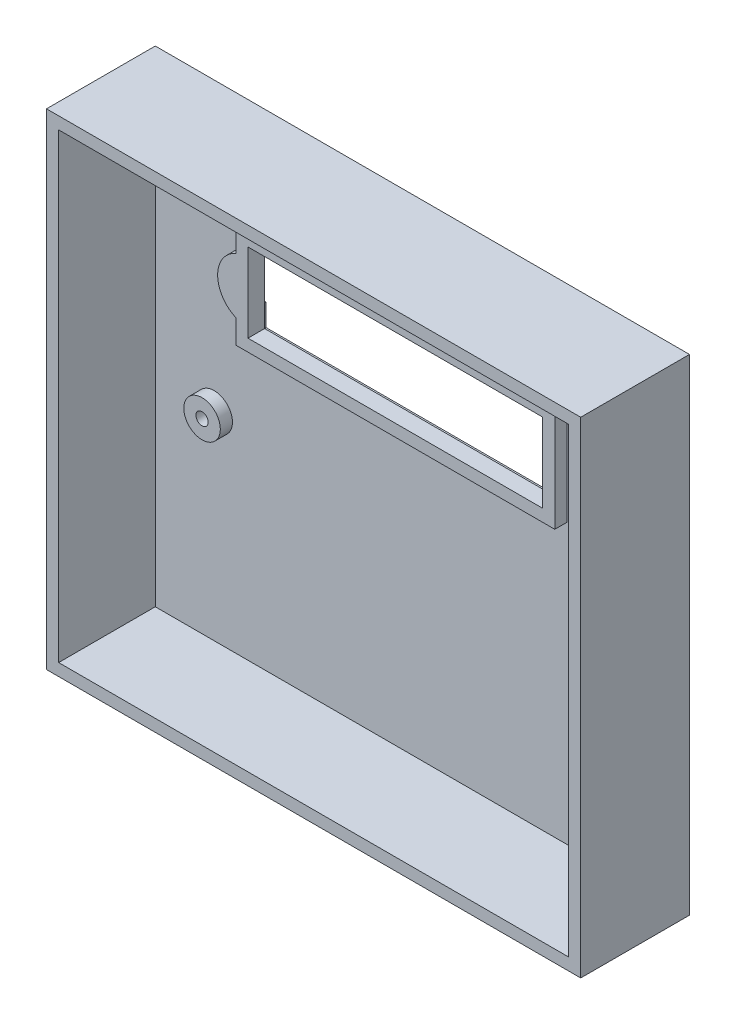
from build123d import *

# Parameters (mm, degrees)
SKETCH1_W                  = 139.7
SKETCH1_H                  = 127
PLATE_WIDTH_DEPTH          = 6.35
SKETCH2_R                  = 1.6002
SKETCH2_W                  = 77.0509
SKETCH2_H                  = 20.6502
THROUGH_HOLES_DEPTH        = 6.35
SKETCH3_R                  = 6.35
SKETCH3_W                  = 80.2259
SKETCH3_H                  = 23.8252
SKETCH3_W_2                = 77.0509
SKETCH3_H_2                = 20.6502
COVER_CUTOUT_DEPTH         = 2
NUT_INSET_DEPTH            = 1.5875
MATERIAL_REMOVAL_OUTLINE_W = 133.35
MATERIAL_REMOVAL_OUTLINE_H = 120.65
MATERIAL_REMOVAL_OUTLINE_R = 4.7752
MATERIAL_REMOVAL_DEPTH     = 3.175
SKETCH6_W                  = 139.7
SKETCH6_H                  = 127
SKETCH6_W_2                = 133.35
SKETCH6_H_2                = 120.65
BOSS_EXTRUDE1_DEPTH        = 22.098


# Read off the part's stored shape, not the designer's step: Material Removal
with BuildPart() as part:
    # Sketch1 → Plate Width (new body)
    with BuildSketch(Plane.XY):
        Rectangle(SKETCH1_W, SKETCH1_H)
    extrude(amount=PLATE_WIDTH_DEPTH)

    # Sketch2 → Through Holes (cut)
    with BuildSketch(Plane.XY.offset(6.35)):
        with Locations((-51.2699, 46.45025)):
            Circle(SKETCH2_R)
        with Locations((-51.2699, -8.44931)):
            Circle(SKETCH2_R)
        with Locations((50.76952, -8.44931)):
            Circle(SKETCH2_R)
        with Locations((50.76952, 46.45025)):
            Circle(SKETCH2_R)
        with Locations((-0.73025, 26.13025)):
            Rectangle(SKETCH2_W, SKETCH2_H)
    extrude(amount=-THROUGH_HOLES_DEPTH, mode=Mode.SUBTRACT)

    # Sketch3 → Cover Cutout (cut)
    # profile 1 of 4: a face of its own
    with BuildSketch(Plane.XY):
        with Locations((-39.2557, 26.13025)):
            Circle(SKETCH3_R)
    # profile 2 of 4: a face of its own
    with BuildSketch(Plane.XY):
        with Locations((-0.73025, 26.13025)):
            Rectangle(SKETCH3_W, SKETCH3_H)
        with Locations((-0.73025, 26.13025)):
            Rectangle(SKETCH3_W_2, SKETCH3_H_2, mode=Mode.SUBTRACT)
    # profile 3 of 4: a face of its own
    with BuildSketch(Plane.XY):
        with BuildLine():
            Line((-40.8432, 19.981888938), (-40.8432, 32.278611062))
            ThreePointArc((-40.8432, 32.278611062), (-45.6057, 26.13025), (-40.8432, 19.981888938))
        make_face()
    # profile 4 of 4: a face of its own
    with BuildSketch(Plane.XY):
        with BuildLine():
            Line((-39.2557, 19.78025), (-39.2557, 32.48025))
            ThreePointArc((-39.2557, 32.48025), (-40.055827257, 32.429638571), (-40.8432, 32.278611062))
            Line((-40.8432, 32.278611062), (-40.8432, 19.981888938))
            ThreePointArc((-40.8432, 19.981888938), (-40.055827257, 19.830861429), (-39.2557, 19.78025))
        make_face()
    extrude(amount=COVER_CUTOUT_DEPTH, mode=Mode.SUBTRACT)

    # Sketch4 → Nut Inset (cut)
    with BuildSketch(Plane.XY.offset(2)):
        Polygon((-41.514156448, 24.54275), (-40.597612895, 26.13025), (-41.514156448, 27.71775), (-43.347243552, 27.71775), (-44.263787105, 26.13025), (-43.347243552, 24.54275), align=None)
    extrude(amount=NUT_INSET_DEPTH, mode=Mode.SUBTRACT)

    # Material Removal outline → Material Removal (cut)
    with BuildSketch(Plane(origin=(0, 0, 6.35), x_dir=(-1, 0, 0), z_dir=(0, 0, -1))):
        Rectangle(MATERIAL_REMOVAL_OUTLINE_W, MATERIAL_REMOVAL_OUTLINE_H)
        with Locations((-50.76952, -8.44931)):
            Circle(MATERIAL_REMOVAL_OUTLINE_R, mode=Mode.SUBTRACT)
        with Locations((51.2699, -8.44931)):
            Circle(MATERIAL_REMOVAL_OUTLINE_R, mode=Mode.SUBTRACT)
        with Locations((-50.76952, 46.45025)):
            Circle(MATERIAL_REMOVAL_OUTLINE_R, mode=Mode.SUBTRACT)
        with BuildLine():
            Line((42.4307, 39.63035), (42.4307, 33.405088916))
            ThreePointArc((42.4307, 33.405088916), (47.1932, 26.13025), (42.4307, 18.855411084))
            Line((42.4307, 18.855411084), (42.4307, 12.63015))
            Line((42.4307, 12.63015), (-40.9702, 12.63015))
            Line((-40.9702, 12.63015), (-40.9702, 39.63035))
            Line((-40.9702, 39.63035), (42.4307, 39.63035))
        make_face(mode=Mode.SUBTRACT)
        with Locations((51.2699, 46.45025)):
            Circle(MATERIAL_REMOVAL_OUTLINE_R, mode=Mode.SUBTRACT)
    extrude(amount=MATERIAL_REMOVAL_DEPTH, mode=Mode.SUBTRACT)

    # Sketch6 → Boss-Extrude1 (add)
    with BuildSketch(Plane.XY.offset(6.35)):
        Rectangle(SKETCH6_W, SKETCH6_H)
        Rectangle(SKETCH6_W_2, SKETCH6_H_2, mode=Mode.SUBTRACT)
    extrude(amount=BOSS_EXTRUDE1_DEPTH)


solid = part.part
